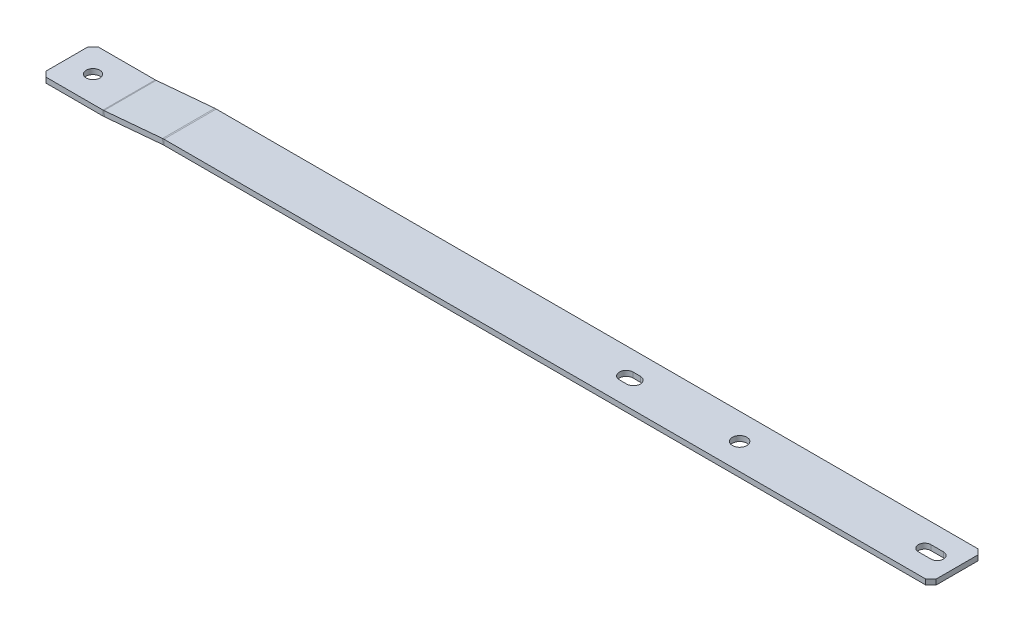
from build123d import *

# Parameters (mm, degrees)
SM_BASE_FLANGE_1_DEPTH = 50
SKETCH_4_R             = 6.9
CUT_EXTRUDE_3_DEPTH    = 10
SKETCH_5_R             = 6.5
CUT_EXTRUDE_4_DEPTH    = 10
OTHER_START            = -10
OTHER_1_DEPTH          = 10
CUT_EXTRUDE_5_DEPTH    = 10


# Read off the part's stored shape, not the designer's step: Затупленный угол1
# Sheet-metal steps are written as plain solids
with BuildPart() as part:
    # Sketch 1 → Базовая кромка1 (new body)
    with BuildSketch(Plane.XY):
        with BuildLine():
            Line((-851.5, -5), (-791.936609429, -5))
            ThreePointArc((-791.936609429, -5), (-791.500415555, -4.990482216), (-791.065052002, -4.961946981))
            Line((-791.065052002, -4.961946981), (-735.002160484, -0.057079529))
            ThreePointArc((-735.002160484, -0.057079529), (-734.349115153, -0.014276676), (-733.694824343, 0))
            Line((-733.694824343, 0), (0, 0))
            Line((0, 0), (0, -5))
            Line((0, -5), (-733.694824343, -5))
            ThreePointArc((-733.694824343, -5), (-734.131018216, -5.009517784), (-734.56638177, -5.038053019))
            Line((-734.56638177, -5.038053019), (-790.629273288, -9.942920471))
            ThreePointArc((-790.629273288, -9.942920471), (-791.282318619, -9.985723324), (-791.936609429, -10))
            Line((-791.936609429, -10), (-851.5, -10))
            Line((-851.5, -10), (-851.5, -5))
        make_face()
    extrude(amount=SM_BASE_FLANGE_1_DEPTH)

    # Эскиз4 → Вырез-Вытянуть3 (cut)
    with BuildSketch(Plane(origin=(0, 0, 0), x_dir=(1, 0, 0), z_dir=(0, 1, 0))):
        with Locations(Location((-208, -25, 0), (0, 0, 270))):
            Circle(SKETCH_4_R)
        with BuildLine():
            Line((-309.5, -31.5), (-316.5, -31.5))
            ThreePointArc((-316.5, -31.5), (-323, -25), (-316.5, -18.5))
            Line((-316.5, -18.5), (-309.5, -18.5))
            ThreePointArc((-309.5, -18.5), (-303, -25), (-309.5, -31.5))
        make_face()
    extrude(amount=-CUT_EXTRUDE_3_DEPTH, mode=Mode.SUBTRACT)

    # Эскиз5 → Вырез-Вытянуть4 (cut)
    with BuildSketch(Plane(origin=(0, -5, 0), x_dir=(1, 0, 0), z_dir=(0, 1, 0))):
        with Locations(Location((-826.5, -25, 0), (0, 0, 180))):
            Circle(SKETCH_5_R)
    extrude(amount=-CUT_EXTRUDE_4_DEPTH, mode=Mode.SUBTRACT)

    # Other 1 outline → Other 1 (cut)
    with BuildSketch(Plane(origin=(0, 0, 0), x_dir=(1, 0, 0), z_dir=(0, 1, 0)).offset(OTHER_START)):
        Polygon((0, 0), (-5, 0), (0, -5), align=None)
        Polygon((0, -50), (0, -45), (-5, -50), align=None)
        Polygon((-851.5, 0), (-851.5, -5), (-846.5, 0), align=None)
        Polygon((-846.5, -50), (-851.5, -45), (-851.5, -50), align=None)
    extrude(amount=OTHER_1_DEPTH, mode=Mode.SUBTRACT)

    # Эскиз6 → Вырез-Вытянуть5 (cut)
    with BuildSketch(Plane(origin=(0, 0, 0), x_dir=(1, 0, 0), z_dir=(0, 1, 0))):
        with BuildLine():
            Line((-19, -31), (-31, -31))
            ThreePointArc((-31, -31), (-37, -25), (-31, -19))
            Line((-31, -19), (-19, -19))
            ThreePointArc((-19, -19), (-13, -25), (-19, -31))
        make_face()
    extrude(amount=-CUT_EXTRUDE_5_DEPTH, mode=Mode.SUBTRACT)


solid = part.part
